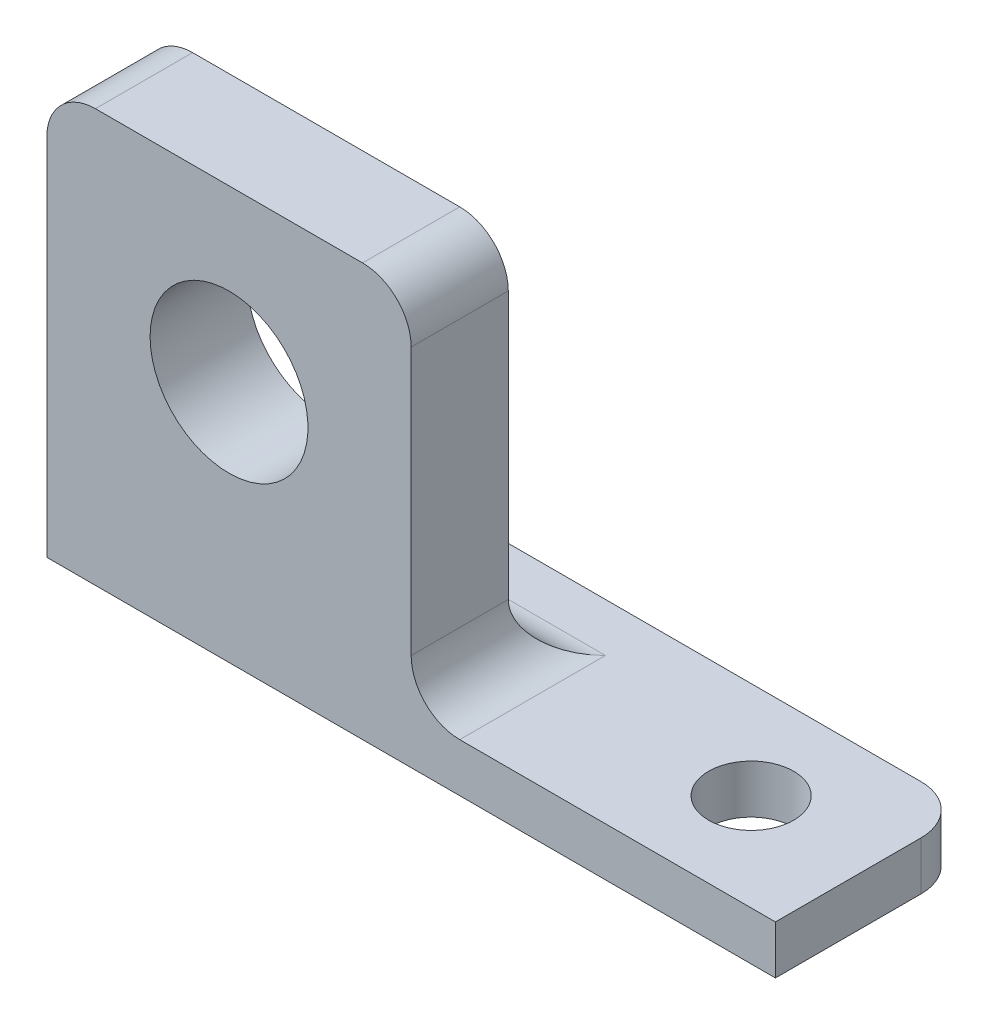
from build123d import *

# Parameters (mm, degrees)
CROQUIS1_W              = 30
CROQUIS1_H              = 8
CROQUIS1_R              = 1.75
SALIENTE_EXTRUIR1_DEPTH = 2
CROQUIS2_W              = 15
CROQUIS2_H              = 4
SALIENTE_EXTRUIR2_DEPTH = 15
CROQUIS3_R              = 3.25
CORTAR_EXTRUIR1_DEPTH   = 4
REDONDEO1_R             = 2


with BuildPart() as part:
    # Croquis1 → Saliente-Extruir1 (new body)
    with BuildSketch(Plane(origin=(0, 0, 0), x_dir=(1, 0, 0), z_dir=(0, 1, 0))):
        with Locations((-15, 4)):
            Rectangle(CROQUIS1_W, CROQUIS1_H)
        with Locations(Location((-5, 4, 0), (0, 0, 270))):
            Circle(CROQUIS1_R, mode=Mode.SUBTRACT)
    extrude(amount=SALIENTE_EXTRUIR1_DEPTH)

    # Croquis2 → Saliente-Extruir2 (add)
    with BuildSketch(Plane(origin=(0, 2, 0), x_dir=(1, 0, 0), z_dir=(0, 1, 0))):
        with Locations((-22.5, 2)):
            Rectangle(CROQUIS2_W, CROQUIS2_H)
    extrude(amount=SALIENTE_EXTRUIR2_DEPTH)

    # Croquis3 → Cortar-Extruir1 (cut)
    with BuildSketch(Plane(origin=(0, 0, -4), x_dir=(-1, 0, 0), z_dir=(0, 0, -1))):
        with Locations((22.5, 10)):
            Circle(CROQUIS3_R)
    extrude(amount=-CORTAR_EXTRUIR1_DEPTH, mode=Mode.SUBTRACT)

    # Redondeo1
    redondeo1_edges = [part.edges().sort_by_distance(p)[0] for p in [
        (0, 1, -8),
        (-30, 1, -8),
        (-30, 17, -2),
        (-15, 17, -2),
        (-22.5, 2, -4),
        (-15, 2, -2),
    ]]
    fillet(redondeo1_edges, radius=REDONDEO1_R - 0.0001)  # a hair under: the kernel refuses the full size


solid = part.part
